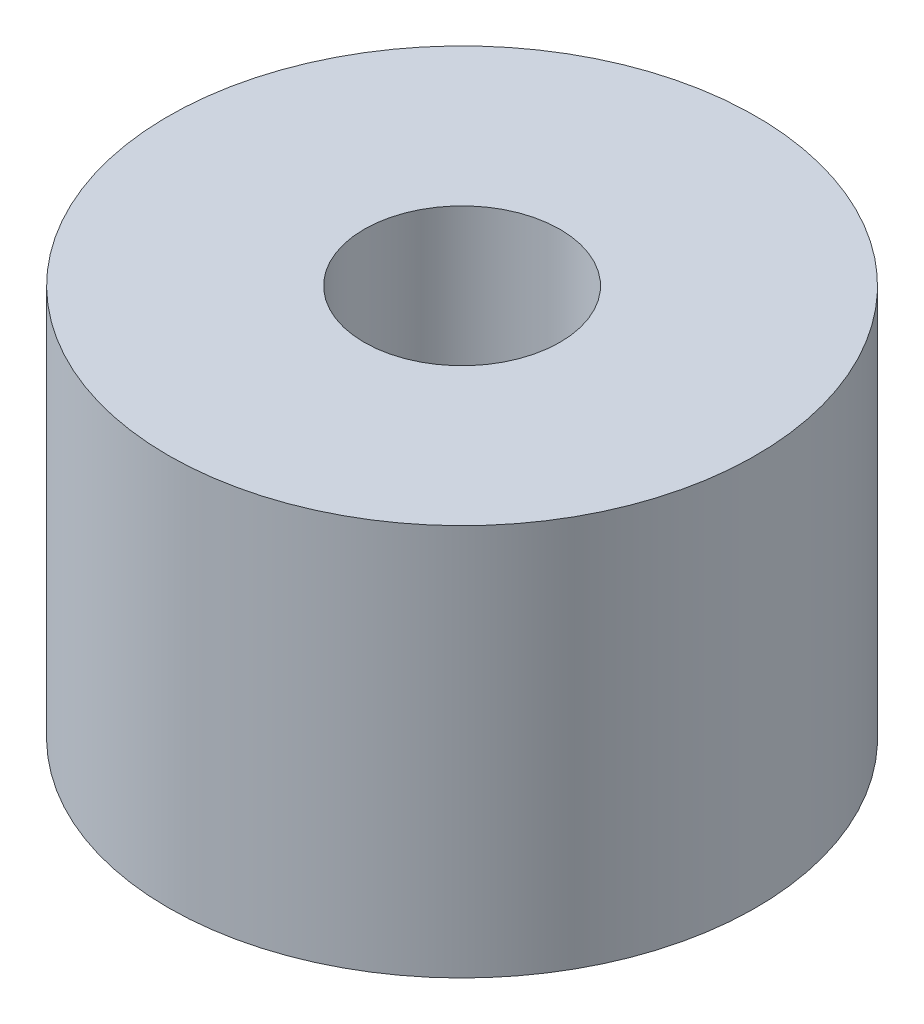
from build123d import *

# Parameters (mm, degrees)
SKETCH1_R           = 4.7625
SKETCH1_R_2         = 1.5875
BOSS_EXTRUDE1_DEPTH = 6.35


with BuildPart() as part:
    # Sketch1 → Boss-Extrude1 (new body)
    with BuildSketch(Plane(origin=(0, 0, 0), x_dir=(1, 0, 0), z_dir=(0, 1, 0))):
        Circle(SKETCH1_R)
        Circle(SKETCH1_R_2, mode=Mode.SUBTRACT)
    extrude(amount=BOSS_EXTRUDE1_DEPTH)


solid = part.part
